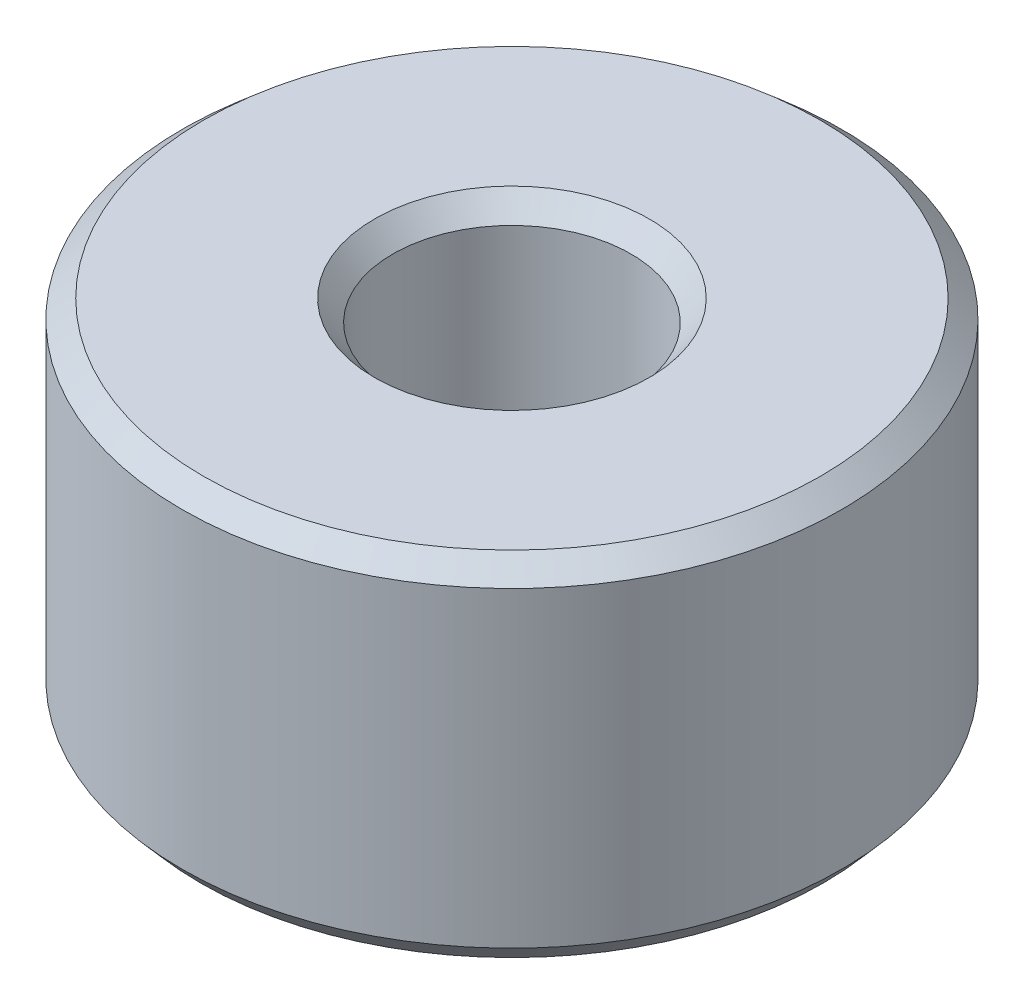
from build123d import *
from OCP.BRepFilletAPI import BRepFilletAPI_MakeChamfer

# Parameters (mm, degrees)
SKETCH1_R           = 17.5
BOSS_EXTRUDE1_DEPTH = 18.636003151
SKETCH2_R           = 6.322282919
CUT_EXTRUDE1_DEPTH  = 31.980649016
CHAMFER1_SIZE       = 0.974849316
CHAMFER1_SIZE2      = 1.120995207


with BuildPart() as part:
    # Sketch1 → Boss-Extrude1 (new body)
    with BuildSketch(Plane(origin=(0, 0, 0), x_dir=(1, 0, 0), z_dir=(0, 1, 0))):
        Circle(SKETCH1_R)
    extrude(amount=BOSS_EXTRUDE1_DEPTH)

    # Sketch2 → Cut-Extrude1 (cut, through all)
    with BuildSketch(Plane(origin=(0, 0, 0), x_dir=(1, 0, 0), z_dir=(0, 1, 0))):
        Circle(SKETCH2_R)
    extrude(amount=CUT_EXTRUDE1_DEPTH, mode=Mode.SUBTRACT)

    # Chamfer1: one chamfer whose edges measure the first distance from different faces: ONE call of the kernel's chamfer builder (chamfer() names one face for all edges)
    chamfer1_edges_1 = [part.edges().sort_by_distance(p)[0] for p in [
        (-6.322282919, 18.636003151, 0),
    ]]
    chamfer1_side_1 = [part.faces().sort_by_distance(p)[0] for p in [
        (-17.005025253, 18.636003151, 0),
    ]]
    chamfer1_edges_2 = [part.edges().sort_by_distance(p)[0] for p in [
        (-6.322282919, 0, 0),
    ]]
    chamfer1_side_2 = [part.faces().sort_by_distance(p)[0] for p in [
        (-6.322282919, 9.318001576, 0),
    ]]
    chamfer1_edges_3 = [part.edges().sort_by_distance(p)[0] for p in [
        (-17.5, 0, 0),
    ]]
    chamfer1_side_3 = [part.faces().sort_by_distance(p)[0] for p in [
        (-17.005025253, 0, 0),
    ]]
    chamfer1_edges_4 = [part.edges().sort_by_distance(p)[0] for p in [
        (-17.5, 18.636003151, 0),
    ]]
    chamfer1_side_4 = [part.faces().sort_by_distance(p)[0] for p in [
        (-17.5, 9.318001576, 0),
    ]]
    chamfer1 = BRepFilletAPI_MakeChamfer(part.part.solid().wrapped)
    for e in chamfer1_edges_1:
        chamfer1.Add(CHAMFER1_SIZE, CHAMFER1_SIZE2, e.wrapped, chamfer1_side_1[0].wrapped)  # the first distance lies on this face
    for e in chamfer1_edges_2:
        chamfer1.Add(CHAMFER1_SIZE, CHAMFER1_SIZE2, e.wrapped, chamfer1_side_2[0].wrapped)  # the first distance lies on this face
    for e in chamfer1_edges_3:
        chamfer1.Add(CHAMFER1_SIZE, CHAMFER1_SIZE2, e.wrapped, chamfer1_side_3[0].wrapped)  # the first distance lies on this face
    for e in chamfer1_edges_4:
        chamfer1.Add(CHAMFER1_SIZE, CHAMFER1_SIZE2, e.wrapped, chamfer1_side_4[0].wrapped)  # the first distance lies on this face
    add(Compound.cast(chamfer1.Shape()), mode=Mode.REPLACE)


solid = part.part
